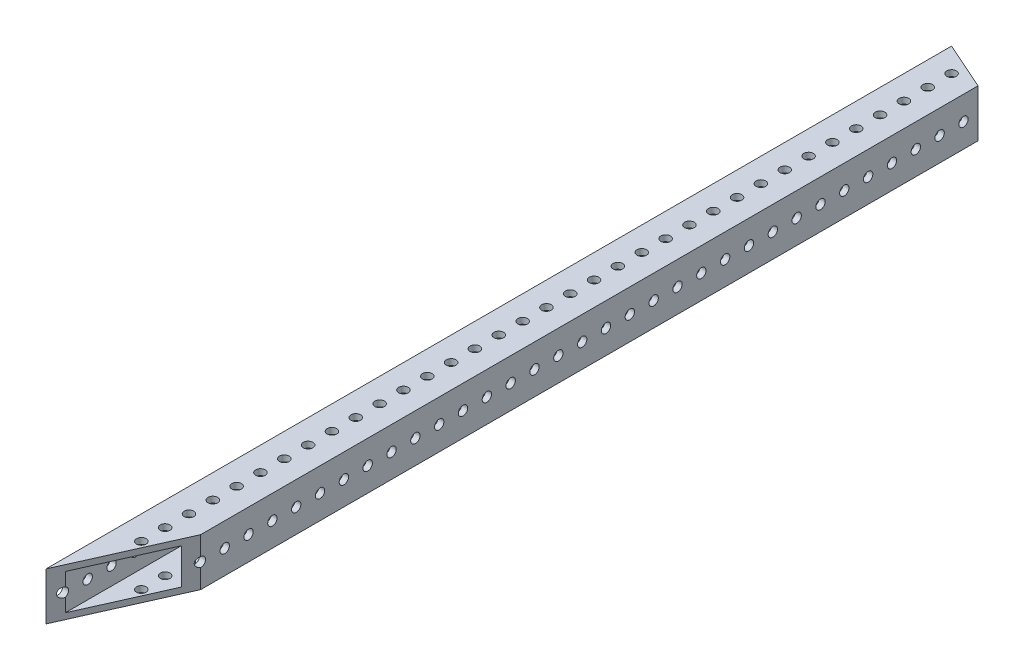
from build123d import *

# Parameters (mm, degrees)
SKETCH1_W           = 25.4
SKETCH1_H           = 25.4
SKETCH1_W_2         = 19.05
SKETCH1_H_2         = 19.05
BOSS_EXTRUDE1_DEPTH = 241.3
SKETCH2_R           = 2.5527
CUT_EXTRUDE1_DEPTH  = 243.965306165
SKETCH4_R           = 2.4892
CUT_EXTRUDE3_DEPTH  = 243.965306165
CUT_EXTRUDE4_DEPTH  = 243.965306165
CUT_EXTRUDE5_DEPTH  = 243.965306165


with BuildPart() as part:
    # Sketch1 → Boss-Extrude1 (new, symmetric)
    with BuildSketch(Plane.XY):
        Rectangle(SKETCH1_W, SKETCH1_H)
        Rectangle(SKETCH1_W_2, SKETCH1_H_2, mode=Mode.SUBTRACT)
    extrude(amount=BOSS_EXTRUDE1_DEPTH, both=True)

    # Sketch2 → Cut-Extrude1 (cut, through all)
    with BuildSketch(Plane(origin=(0, 12.7, 0), x_dir=(1, 0, 0), z_dir=(0, 1, 0))):
        with Locations((0, -266.7)):
            Circle(SKETCH2_R)
        with Locations((0, -254)):
            Circle(SKETCH2_R)
        with Locations((0, -241.3)):
            Circle(SKETCH2_R)
        with Locations((0, -203.2)):
            Circle(SKETCH2_R)
        with Locations((0, -190.5)):
            Circle(SKETCH2_R)
        with Locations((0, -177.8)):
            Circle(SKETCH2_R)
        with Locations((0, -165.1)):
            Circle(SKETCH2_R)
        with Locations((0, -152.4)):
            Circle(SKETCH2_R)
        with Locations((0, -139.7)):
            Circle(SKETCH2_R)
        with Locations((0, -127)):
            Circle(SKETCH2_R)
        with Locations((0, -114.3)):
            Circle(SKETCH2_R)
        with Locations((0, -101.6)):
            Circle(SKETCH2_R)
        with Locations((0, -88.9)):
            Circle(SKETCH2_R)
        with Locations((0, -76.2)):
            Circle(SKETCH2_R)
        with Locations((0, -63.5)):
            Circle(SKETCH2_R)
        with Locations((0, -50.8)):
            Circle(SKETCH2_R)
        with Locations((0, -38.1)):
            Circle(SKETCH2_R)
        with Locations((0, -25.4)):
            Circle(SKETCH2_R)
        with Locations((0, -12.7)):
            Circle(SKETCH2_R)
        Circle(SKETCH2_R)
        with Locations((0, 12.7)):
            Circle(SKETCH2_R)
        with Locations((0, 25.4)):
            Circle(SKETCH2_R)
        with Locations((0, 38.1)):
            Circle(SKETCH2_R)
        with Locations((0, 50.8)):
            Circle(SKETCH2_R)
        with Locations((0, 63.5)):
            Circle(SKETCH2_R)
        with Locations((0, 76.2)):
            Circle(SKETCH2_R)
        with Locations((0, 88.9)):
            Circle(SKETCH2_R)
        with Locations((0, 101.6)):
            Circle(SKETCH2_R)
        with Locations((0, 114.3)):
            Circle(SKETCH2_R)
        with Locations((0, 127)):
            Circle(SKETCH2_R)
        with Locations((0, 139.7)):
            Circle(SKETCH2_R)
        with Locations((0, 152.4)):
            Circle(SKETCH2_R)
        with Locations((0, 165.1)):
            Circle(SKETCH2_R)
        with Locations((0, 177.8)):
            Circle(SKETCH2_R)
        with Locations((0, 190.5)):
            Circle(SKETCH2_R)
        with Locations((0, 203.2)):
            Circle(SKETCH2_R)
        with Locations((0, 215.9)):
            Circle(SKETCH2_R)
        with Locations((0, 228.6)):
            Circle(SKETCH2_R)
        with Locations((0, 241.3)):
            Circle(SKETCH2_R)
        with Locations((0, 254)):
            Circle(SKETCH2_R)
        with Locations((0, 266.7)):
            Circle(SKETCH2_R)
        with Locations((0, 279.4)):
            Circle(SKETCH2_R)
        with Locations((0, 292.1)):
            Circle(SKETCH2_R)
    extrude(amount=-CUT_EXTRUDE1_DEPTH, mode=Mode.SUBTRACT)

    # Sketch4 → Cut-Extrude3 (cut, through all)
    with BuildSketch(Plane(origin=(12.7, 0, 0), x_dir=(0, 0, -1), z_dir=(1, 0, 0))):
        with Locations((-234.95, 0)):
            Circle(SKETCH4_R)
        with Locations((-222.25, 0)):
            Circle(SKETCH4_R)
        with Locations((-209.55, 0)):
            Circle(SKETCH4_R)
        with Locations((-196.85, 0)):
            Circle(SKETCH4_R)
        with Locations((-184.15, 0)):
            Circle(SKETCH4_R)
        with Locations((196.85, 0)):
            Circle(SKETCH4_R)
        with Locations((209.55, 0)):
            Circle(SKETCH4_R)
        with Locations((222.25, 0)):
            Circle(SKETCH4_R)
        with Locations((234.95, 0)):
            Circle(SKETCH4_R)
        with Locations((247.65, 0)):
            Circle(SKETCH4_R)
        with Locations((260.35, 0)):
            Circle(SKETCH4_R)
        with Locations((273.05, 0)):
            Circle(SKETCH4_R)
        with Locations((285.75, 0)):
            Circle(SKETCH4_R)
        with Locations((298.45, 0)):
            Circle(SKETCH4_R)
        with Locations((311.15, 0)):
            Circle(SKETCH4_R)
        with Locations((323.85, 0)):
            Circle(SKETCH4_R)
        with Locations((336.55, 0)):
            Circle(SKETCH4_R)
        with Locations((349.25, 0)):
            Circle(SKETCH4_R)
        with Locations((361.95, 0)):
            Circle(SKETCH4_R)
        with Locations((-171.45, 0)):
            Circle(SKETCH4_R)
        with Locations((-158.75, 0)):
            Circle(SKETCH4_R)
        with Locations((-146.05, 0)):
            Circle(SKETCH4_R)
        with Locations((-133.35, 0)):
            Circle(SKETCH4_R)
        with Locations((-120.65, 0)):
            Circle(SKETCH4_R)
        with Locations((-107.95, 0)):
            Circle(SKETCH4_R)
        with Locations((-95.25, 0)):
            Circle(SKETCH4_R)
        with Locations((-82.55, 0)):
            Circle(SKETCH4_R)
        with Locations((-69.85, 0)):
            Circle(SKETCH4_R)
        with Locations((-57.15, 0)):
            Circle(SKETCH4_R)
        with Locations((-44.45, 0)):
            Circle(SKETCH4_R)
        with Locations((-31.75, 0)):
            Circle(SKETCH4_R)
        with Locations((-19.05, 0)):
            Circle(SKETCH4_R)
        with Locations((-6.35, 0)):
            Circle(SKETCH4_R)
        with Locations((6.35, 0)):
            Circle(SKETCH4_R)
        with Locations((19.05, 0)):
            Circle(SKETCH4_R)
        with Locations((31.75, 0)):
            Circle(SKETCH4_R)
        with Locations((44.45, 0)):
            Circle(SKETCH4_R)
        with Locations((57.15, 0)):
            Circle(SKETCH4_R)
        with Locations((69.85, 0)):
            Circle(SKETCH4_R)
        with Locations((82.55, 0)):
            Circle(SKETCH4_R)
        with Locations((95.25, 0)):
            Circle(SKETCH4_R)
        with Locations((107.95, 0)):
            Circle(SKETCH4_R)
        with Locations((120.65, 0)):
            Circle(SKETCH4_R)
        with Locations((133.35, 0)):
            Circle(SKETCH4_R)
        with Locations((146.05, 0)):
            Circle(SKETCH4_R)
        with Locations((158.75, 0)):
            Circle(SKETCH4_R)
        with Locations((171.45, 0)):
            Circle(SKETCH4_R)
        with Locations((184.15, 0)):
            Circle(SKETCH4_R)
    extrude(amount=-CUT_EXTRUDE3_DEPTH, mode=Mode.SUBTRACT)

    # Sketch6 → Cut-Extrude4 (cut, through all)
    with BuildSketch(Plane(origin=(0, 12.7, 0), x_dir=(1, 0, 0), z_dir=(0, 1, 0))):
        Polygon((-12.7, -241.3), (12.7, -184.250665943), (12.7, -241.3), align=None)
    extrude(amount=-CUT_EXTRUDE4_DEPTH, mode=Mode.SUBTRACT)

    # Sketch7 → Cut-Extrude5 (cut, through all)
    with BuildSketch(Plane(origin=(0, 12.7, 0), x_dir=(1, 0, 0), z_dir=(0, 1, 0))):
        Polygon((-12.7, 241.3), (12.7, 229.991191393), (12.7, 241.3), align=None)
    extrude(amount=-CUT_EXTRUDE5_DEPTH, mode=Mode.SUBTRACT)


solid = part.part
